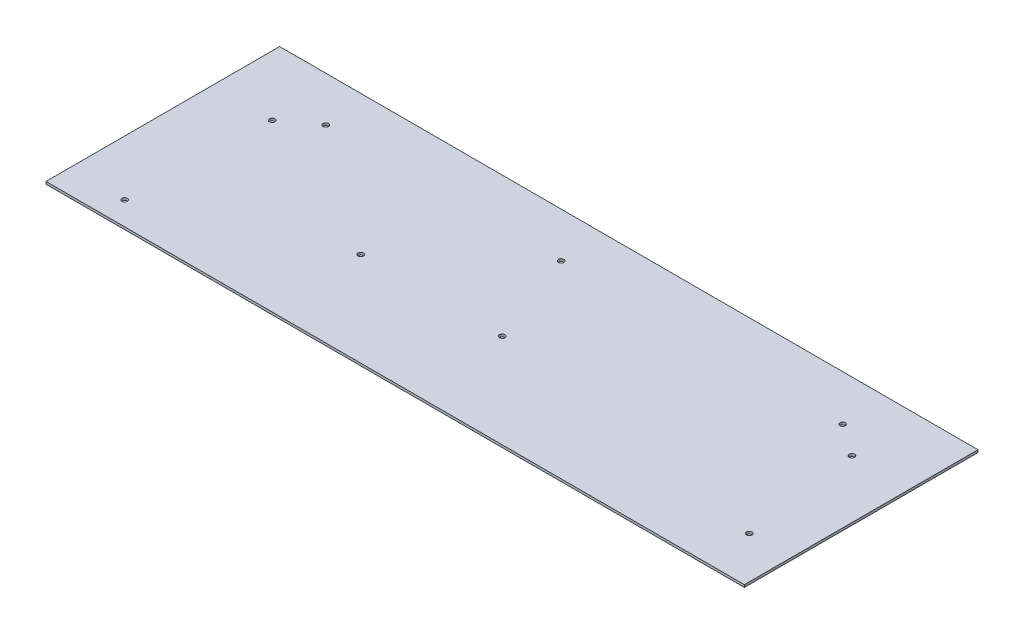
from build123d import *

# Parameters (mm, degrees)
SKETCH3_W             = 284
SKETCH3_H             = 95
BOSS_EXTRUDE1_DEPTH   = 1
F_2_0MM_DOWEL_HOLE1_D = 2.2


with BuildPart() as part:
    # Sketch3 → Boss-Extrude1 (new body)
    with BuildSketch(Plane(origin=(0, 0, 0), x_dir=(1, 0, 0), z_dir=(0, 1, 0))):
        with Locations((165.765656923, 368.514519522)):
            Rectangle(SKETCH3_W, SKETCH3_H)
    extrude(amount=BOSS_EXTRUDE1_DEPTH)

    # Ø2.0mm Dowel Hole1 (through all)
    with Locations(Plane(origin=(0, 1, 0), x_dir=(1, 0, 0), z_dir=(0, 1, 0))):
        with Locations((48.265656923, 388.514519522), (60.765656923, 397.764519522), (46.265656923, 330.514519522), (113.515656923, 359.264519522), (156.515656923, 397.764519522), (171.015656923, 359.264519522), (271.265656923, 397.514519522), (284.265656923, 388.264519522), (290.765656923, 340.014519522)):
            Hole(F_2_0MM_DOWEL_HOLE1_D / 2)


solid = part.part
